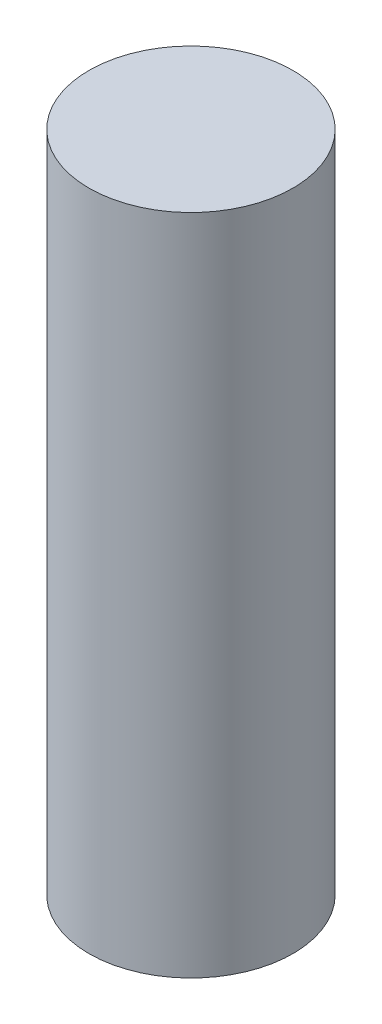
from build123d import *

# Parameters (mm, degrees)
MAIN_PARACHUTE_BAG_PROFILE_R  = 63.5
MAIN_PARACHUTE_BAG_BODY_DEPTH = 412.75


with BuildPart() as part:
    # Main Parachute Bag Profile → Main Parachute Bag Body (new body)
    with BuildSketch(Plane(origin=(0, 0, 0), x_dir=(1, 0, 0), z_dir=(0, 1, 0))):
        Circle(MAIN_PARACHUTE_BAG_PROFILE_R)
    extrude(amount=MAIN_PARACHUTE_BAG_BODY_DEPTH)


solid = part.part
